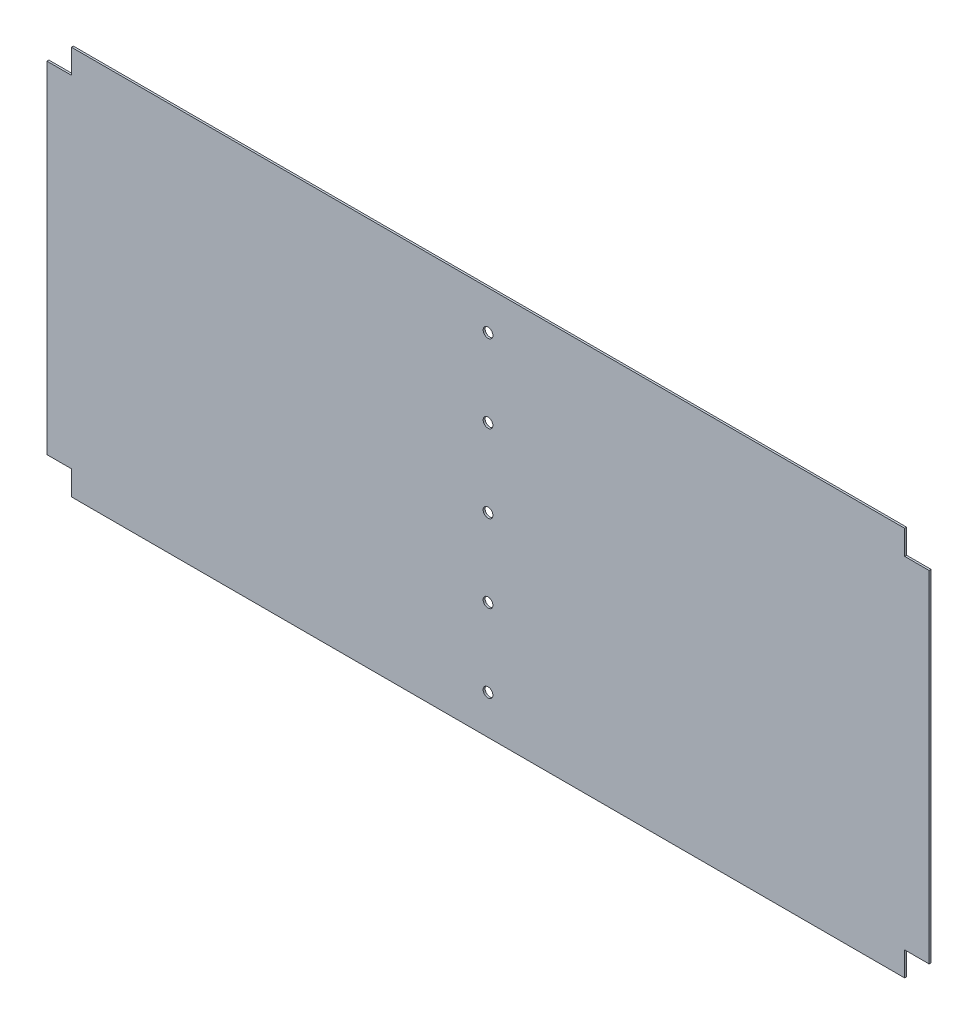
from build123d import *

# Parameters (mm, degrees)
IZIM1_W               = 906
IZIM1_H               = 400
TABAN_FLAN_1_DEPTH    = 2
IZIM6_W               = 25
IZIM6_H               = 25
KES_EKSTR_ZYON1_DEPTH = 10
IZIM7_R               = 5
KES_EKSTR_ZYON2_DEPTH = 10


# Sheet-metal steps are written as plain solids
with BuildPart() as part:
    # Çizim1 → Taban-Flanş1 (new body)
    with BuildSketch(Plane.XY):
        with Locations((0, 200)):
            Rectangle(IZIM1_W, IZIM1_H)
    extrude(amount=-TABAN_FLAN_1_DEPTH)

    # Çizim6 → Kes-Ekstrüzyon1 (cut)
    with BuildSketch(Plane.XY):
        with Locations((-440.5, 387.5)):
            Rectangle(IZIM6_W, IZIM6_H)
        with Locations((440.5, 387.5)):
            Rectangle(IZIM6_W, IZIM6_H)
        with Locations((440.5, 12.5)):
            Rectangle(IZIM6_W, IZIM6_H)
        with Locations((-440.5, 12.5)):
            Rectangle(IZIM6_W, IZIM6_H)
    extrude(amount=-KES_EKSTR_ZYON1_DEPTH, mode=Mode.SUBTRACT)

    # Çizim7 → Kes-Ekstrüzyon2 (cut)
    with BuildSketch(Plane.XY):
        with Locations((0, 360)):
            Circle(IZIM7_R)
        with Locations((0, 280)):
            Circle(IZIM7_R)
        with Locations((0, 200)):
            Circle(IZIM7_R)
        with Locations((0, 120)):
            Circle(IZIM7_R)
        with Locations((0, 40)):
            Circle(IZIM7_R)
    extrude(amount=-KES_EKSTR_ZYON2_DEPTH, mode=Mode.SUBTRACT)


solid = part.part
